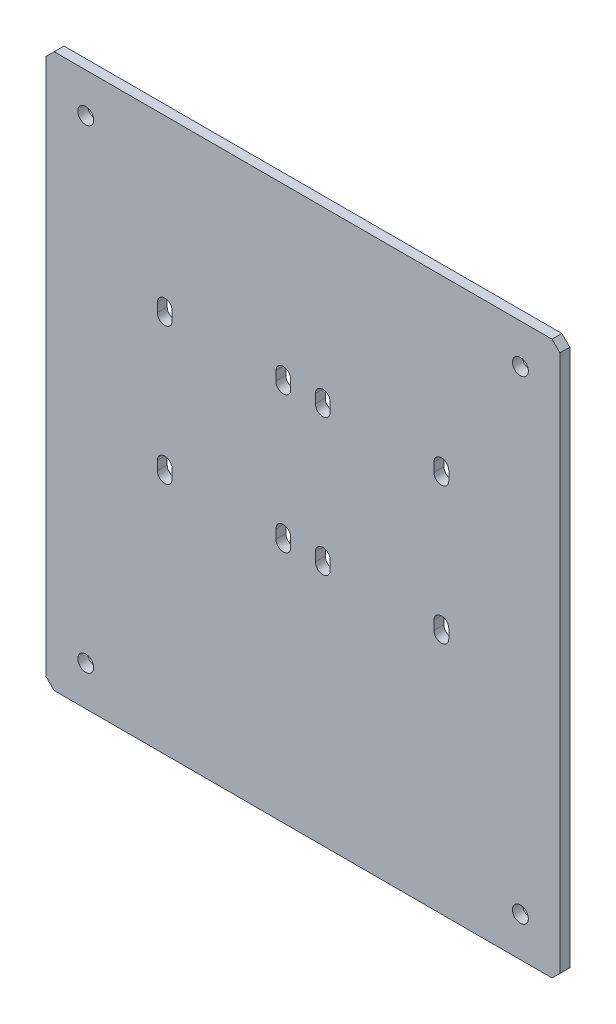
from build123d import *

# Parameters (mm, degrees)
SKETCH1_W              = 165.1
SKETCH1_H              = 177.8
BOSS_EXTRUDE1_DEPTH    = 3.175
CUT_EXTRUDE1_DEPTH     = 243.653931814
F_10_CLEARANCE_HOLE1_D = 5.1054
CHAMFER1_SIZE          = 2.54


with BuildPart() as part:
    # Sketch1 → Boss-Extrude1 (new body)
    with BuildSketch(Plane.XY):
        with Locations((82.55, 88.9)):
            Rectangle(SKETCH1_W, SKETCH1_H)
    extrude(amount=-BOSS_EXTRUDE1_DEPTH)

    # Sketch2 → Cut-Extrude1 (cut, through all)
    with BuildSketch(Plane.XY):
        with BuildLine():
            Line((35.71875, 121.7875), (35.71875, 124.645))
            ThreePointArc((35.71875, 124.645), (38.1, 127.02625), (40.48125, 124.645))
            Line((40.48125, 124.645), (40.48125, 121.7875))
            ThreePointArc((40.48125, 121.7875), (38.1, 119.40625), (35.71875, 121.7875))
        make_face()
        with BuildLine():
            Line((35.71875, 77.7875), (35.71875, 80.645))
            ThreePointArc((35.71875, 80.645), (38.1, 83.02625), (40.48125, 80.645))
            Line((40.48125, 80.645), (40.48125, 77.7875))
            ThreePointArc((40.48125, 77.7875), (38.1, 75.40625), (35.71875, 77.7875))
        make_face()
        with BuildLine():
            Line((78.58125, 124.645), (78.58125, 121.7875))
            ThreePointArc((78.58125, 121.7875), (76.2, 119.40625), (73.81875, 121.7875))
            Line((73.81875, 121.7875), (73.81875, 124.645))
            ThreePointArc((73.81875, 124.645), (76.2, 127.02625), (78.58125, 124.645))
        make_face()
        with BuildLine():
            Line((78.58125, 80.645), (78.58125, 77.7875))
            ThreePointArc((78.58125, 77.7875), (76.2, 75.40625), (73.81875, 77.7875))
            Line((73.81875, 77.7875), (73.81875, 80.645))
            ThreePointArc((73.81875, 80.645), (76.2, 83.02625), (78.58125, 80.645))
        make_face()
        with BuildLine():
            Line((129.38125, 121.7875), (129.38125, 124.645))
            ThreePointArc((129.38125, 124.645), (127, 127.02625), (124.61875, 124.645))
            Line((124.61875, 124.645), (124.61875, 121.7875))
            ThreePointArc((124.61875, 121.7875), (127, 119.40625), (129.38125, 121.7875))
        make_face()
        with BuildLine():
            Line((129.38125, 77.7875), (129.38125, 80.645))
            ThreePointArc((129.38125, 80.645), (127, 83.02625), (124.61875, 80.645))
            Line((124.61875, 80.645), (124.61875, 77.7875))
            ThreePointArc((124.61875, 77.7875), (127, 75.40625), (129.38125, 77.7875))
        make_face()
        with BuildLine():
            Line((86.51875, 124.645), (86.51875, 121.7875))
            ThreePointArc((86.51875, 121.7875), (88.9, 119.40625), (91.28125, 121.7875))
            Line((91.28125, 121.7875), (91.28125, 124.645))
            ThreePointArc((91.28125, 124.645), (88.9, 127.02625), (86.51875, 124.645))
        make_face()
        with BuildLine():
            Line((86.51875, 80.645), (86.51875, 77.7875))
            ThreePointArc((86.51875, 77.7875), (88.9, 75.40625), (91.28125, 77.7875))
            Line((91.28125, 77.7875), (91.28125, 80.645))
            ThreePointArc((91.28125, 80.645), (88.9, 83.02625), (86.51875, 80.645))
        make_face()
    extrude(amount=-CUT_EXTRUDE1_DEPTH, mode=Mode.SUBTRACT)

    # #10 Clearance Hole1 (through all)
    with Locations(Plane.XY):
        with Locations((12.7, 12.7), (12.7, 165.1), (152.4, 165.1), (152.4, 12.7)):
            Hole(F_10_CLEARANCE_HOLE1_D / 2)

    # Chamfer1
    chamfer1_edges = [part.edges().sort_by_distance(p)[0] for p in [
        (0, 0, -1.5875),
        (165.1, 0, -1.5875),
        (165.1, 177.8, -1.5875),
        (0, 177.8, -1.5875),
    ]]
    chamfer(chamfer1_edges, length=CHAMFER1_SIZE)


solid = part.part
